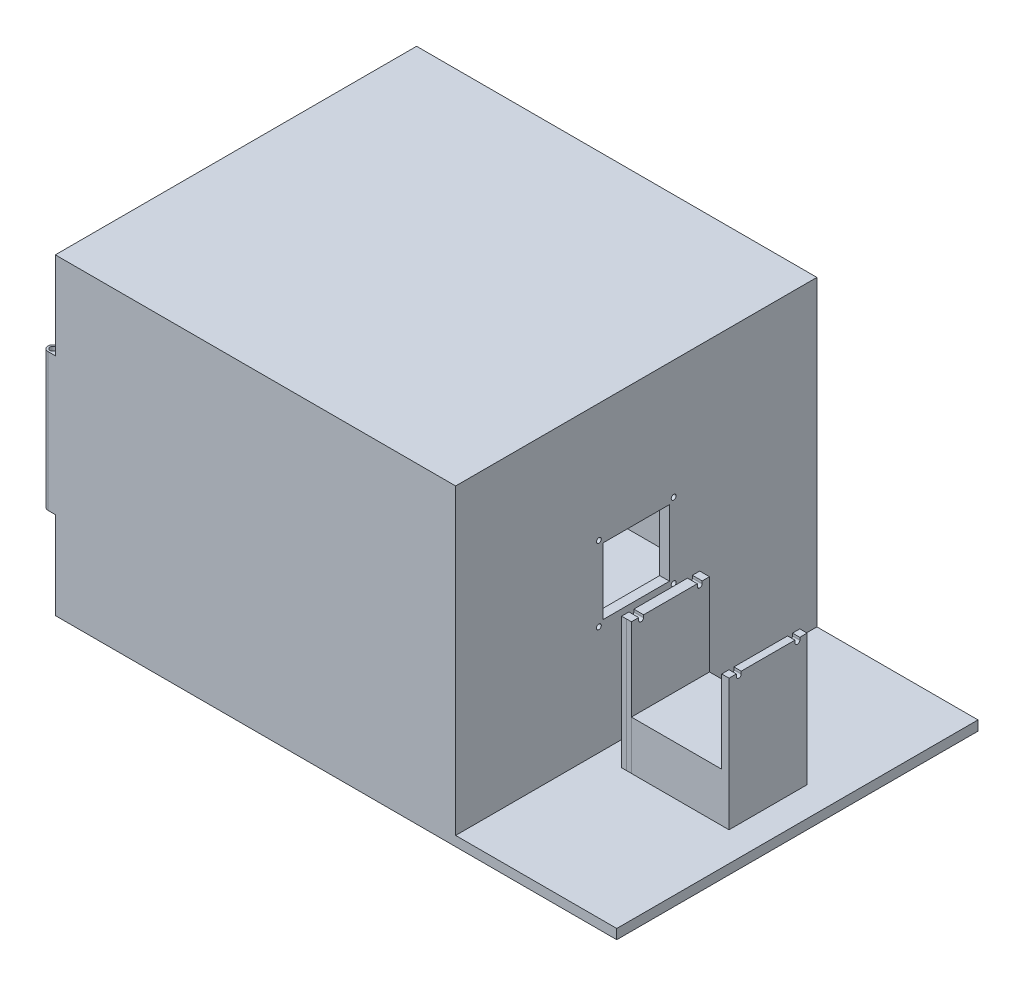
from build123d import *
from build123d.topology import SkipClean

# Parameters (mm, degrees)
SKETCH1_W           = 420
SKETCH1_H           = 370
SKETCH1_W_2         = 400
SKETCH1_H_2         = 350
BOSS_EXTRUDE1_DEPTH = 300
BOSS_EXTRUDE2_DEPTH = 10
SKETCH3_W           = 10
SKETCH3_H           = 310
CUT_EXTRUDE1_DEPTH  = 370
SKETCH6_R           = 2.5
SKETCH6_W           = 68
SKETCH6_H           = 68
CUT_EXTRUDE3_DEPTH  = 10
SKETCH7_W           = 5
SKETCH7_H           = 80
BOSS_EXTRUDE3_DEPTH = 134.5
CUT_EXTRUDE4_REACH  = 646.845
SKETCH9_W           = 5
SKETCH9_H           = 79.931817825
BOSS_EXTRUDE4_DEPTH = 134.5
CUT_EXTRUDE5_REACH  = 516.637
SKETCH10_W          = 6.47899954
SKETCH10_H          = 82.791783562
SKETCH11_W          = 5
SKETCH11_H          = 80
BOSS_EXTRUDE5_DEPTH = 134.5
SKETCH12_W          = 92.5
SKETCH12_H          = 80
BOSS_EXTRUDE6_DEPTH = 50
CUT_EXTRUDE6_START  = -7.5
CUT_EXTRUDE6_DEPTH  = 105
SKETCH15_W          = 410
SKETCH15_H          = 370
BOSS_EXTRUDE7_DEPTH = 10
SKETCH16_W          = 15
SKETCH16_H          = 140.878076228
BOSS_EXTRUDE8_DEPTH = 10
SKETCH17_R          = 3
CUT_EXTRUDE7_DEPTH  = 140.878076229


with BuildPart() as part:
    # Sketch1 → Boss-Extrude1 (new body)
    with BuildSketch(Plane(origin=(0, 0, 0), x_dir=(1, 0, 0), z_dir=(0, 1, 0))):
        Rectangle(SKETCH1_W, SKETCH1_H)
        Rectangle(SKETCH1_W_2, SKETCH1_H_2, mode=Mode.SUBTRACT)
    extrude(amount=BOSS_EXTRUDE1_DEPTH)

    # Sketch2 → Boss-Extrude2 (add)
    with BuildSketch(Plane.XZ):
        Polygon((-210, -185), (210, -185), (215.001407023, -185), (375.001407023, -185), (375.001407023, 185), (215.001407023, 185), (210, 185), (-210, 185), align=None)
    extrude(amount=BOSS_EXTRUDE2_DEPTH)

    # Sketch3 → Cut-Extrude1 (cut)
    with BuildSketch(Plane.XY.offset(185)):
        with Locations((-205, 145)):
            Rectangle(SKETCH3_W, SKETCH3_H)
    extrude(amount=-CUT_EXTRUDE1_DEPTH, mode=Mode.SUBTRACT)

    # Sketch6 → Cut-Extrude3 (cut)
    with BuildSketch(Plane(origin=(210, 0, 0), x_dir=(0, 0, -1), z_dir=(1, 0, 0))):
        with Locations((-38.303, 111.697)):
            Circle(SKETCH6_R)
        with Locations((38.303, 111.697)):
            Circle(SKETCH6_R)
        with Locations((38.303, 188.303)):
            Circle(SKETCH6_R)
        with Locations((-38.303, 188.303)):
            Circle(SKETCH6_R)
        with Locations((0, 150)):
            Rectangle(SKETCH6_W, SKETCH6_H)
    extrude(amount=-CUT_EXTRUDE3_DEPTH, mode=Mode.SUBTRACT)

    # Sketch7 → Boss-Extrude3 (add)
    with BuildSketch(Plane(origin=(0, 0, 0), x_dir=(1, 0, 0), z_dir=(0, 1, 0))):
        with Locations((237.5, 0)):
            Rectangle(SKETCH7_W, SKETCH7_H)
        with Locations((337.5, 0)):
            Rectangle(SKETCH7_W, SKETCH7_H)
    extrude(amount=BOSS_EXTRUDE3_DEPTH)

    # Cut-Extrude4: up to this face of the body (flat: up to its plane)
    cut_extrude4_end = Plane(part.part.faces().sort_by_distance((235, 67.25, 0))[0])
    # Sketch8 → Cut-Extrude4 (cut, up to the picked face)
    with BuildSketch(Plane(origin=(340, 0, 0), x_dir=(0, 0, -1), z_dir=(1, 0, 0)), mode=Mode.PRIVATE) as cut_extrude4_sk1:
        with BuildLine():
            Line((-32.5, 136.110518), (-32.220758703, 136.631471953))
            Line((-32.220758703, 136.631471953), (-27.5, 136.631471953))
            Line((-27.5, 136.631471953), (-27.5, 132))
            ThreePointArc((-27.5, 132), (-30, 129.5), (-32.5, 132))
            Line((-32.5, 132), (-32.5, 136.110518))
        make_face()
    cut_extrude4_tool1 = split(extrude(cut_extrude4_sk1.sketch, amount=-CUT_EXTRUDE4_REACH, mode=Mode.PRIVATE), bisect_by=cut_extrude4_end, keep=Keep.BOTH, mode=Mode.PRIVATE)
    # Sketch8 → Cut-Extrude4 (cut, up to the picked face)
    with BuildSketch(Plane(origin=(340, 0, 0), x_dir=(0, 0, -1), z_dir=(1, 0, 0)), mode=Mode.PRIVATE) as cut_extrude4_sk2:
        with BuildLine():
            Line((27.5, 132), (27.5, 136.631471953))
            Line((27.5, 136.631471953), (32.220758703, 136.631471953))
            Line((32.220758703, 136.631471953), (32.5, 136.110518))
            Line((32.5, 136.110518), (32.5, 132))
            ThreePointArc((32.5, 132), (30, 129.5), (27.5, 132))
        make_face()
    cut_extrude4_tool2 = split(extrude(cut_extrude4_sk2.sketch, amount=-CUT_EXTRUDE4_REACH, mode=Mode.PRIVATE), bisect_by=cut_extrude4_end, keep=Keep.BOTH, mode=Mode.PRIVATE)
    add(cut_extrude4_tool1.solids().sort_by(Axis((340, 133.303425, 29.994679), (-1, 0, 0)))[0], mode=Mode.SUBTRACT)
    add(cut_extrude4_tool2.solids().sort_by(Axis((340, 133.303425, -29.994679), (-1, 0, 0)))[0], mode=Mode.SUBTRACT)

    # Sketch9 → Boss-Extrude4 (add)
    with BuildSketch(Plane(origin=(0, 0, 0), x_dir=(1, 0, 0), z_dir=(0, 1, 0))):
        with Locations((242.5, 0.034091087)):
            Rectangle(SKETCH9_W, SKETCH9_H)
    extrude(amount=BOSS_EXTRUDE4_DEPTH)

    # Cut-Extrude5: up to this face of the body (flat: up to its plane)
    cut_extrude5_end = Plane(part.part.faces().sort_by_distance((337.5, 134.5, 0))[0])
    # Sketch10 → Cut-Extrude5 (cut, up to the picked face)
    with BuildSketch(Plane(origin=(0, 0, 0), x_dir=(1, 0, 0), z_dir=(0, 1, 0)), mode=Mode.PRIVATE) as cut_extrude5_sk1:
        with Locations((334.26050023, 1.395891781)):
            Rectangle(SKETCH10_W, SKETCH10_H)
    cut_extrude5_tool1 = split(extrude(cut_extrude5_sk1.sketch, amount=CUT_EXTRUDE5_REACH, mode=Mode.PRIVATE), bisect_by=cut_extrude5_end, keep=Keep.BOTH, mode=Mode.PRIVATE)
    add(cut_extrude5_tool1.solids().sort_by(Axis((334.2605, 0, -1.395892), (0, 1, 0)))[0], mode=Mode.SUBTRACT)

    # Sketch11 → Boss-Extrude5 (add)
    with BuildSketch(Plane(origin=(0, 0, 0), x_dir=(1, 0, 0), z_dir=(0, 1, 0))):
        with Locations((342.5, 0)):
            Rectangle(SKETCH11_W, SKETCH11_H)
    extrude(amount=BOSS_EXTRUDE5_DEPTH)

    # Sketch12 → Boss-Extrude6 (add)
    with BuildSketch(Plane(origin=(0, 0, 0), x_dir=(1, 0, 0), z_dir=(0, 1, 0))):
        with Locations((291.25, 0)):
            Rectangle(SKETCH12_W, SKETCH12_H)
    extrude(amount=BOSS_EXTRUDE6_DEPTH)

    # Sketch13 → Cut-Extrude6 (cut)
    with SkipClean():  # the faces are left unmerged after this step: merging them gives an invalid solid
        with BuildSketch(Plane.ZY.offset(-337.5).offset(CUT_EXTRUDE6_START)):
            with BuildLine():
                Line((-32.5, 132), (-32.5, 134.5))
                Line((-32.5, 134.5), (-27.5, 134.5))
                Line((-27.5, 134.5), (-27.5, 132))
                ThreePointArc((-27.5, 132), (-30, 129.5), (-32.5, 132))
            make_face()
            with BuildLine():
                Line((27.5, 132), (27.5, 134.5))
                Line((27.5, 134.5), (32.5, 134.5))
                Line((32.5, 134.5), (32.5, 132))
                ThreePointArc((32.5, 132), (30, 129.5), (27.5, 132))
            make_face()
        extrude(amount=CUT_EXTRUDE6_DEPTH, mode=Mode.SUBTRACT)
    add(part.part.scale(1), mode=Mode.REPLACE)  # the faces are merged on a copy

    # Sketch15 → Boss-Extrude7 (add)
    with BuildSketch(Plane(origin=(0, 300, 0), x_dir=(1, 0, 0), z_dir=(0, 1, 0))):
        with Locations((5, 0)):
            Rectangle(SKETCH15_W, SKETCH15_H)
    extrude(amount=BOSS_EXTRUDE7_DEPTH)

    # Sketch16 → Boss-Extrude8 (add)
    with BuildSketch(Plane.XY.offset(185)):
        with Locations((-207.5, 150)):
            Rectangle(SKETCH16_W, SKETCH16_H)
    extrude(amount=-BOSS_EXTRUDE8_DEPTH)

    # Sketch17 → Cut-Extrude7 (cut)
    with BuildSketch(Plane(origin=(0, 220.439038114, 0), x_dir=(1, 0, 0), z_dir=(0, 1, 0))):
        with Locations(Location((-207.5, -180, 0), (0, 0, 270))):
            Circle(SKETCH17_R)
        with BuildLine():
            Line((-207.5, -175), (-209.035864649, -172.521100774))
            Line((-209.035864649, -172.521100774), (-216.595230293, -172.09067426))
            Line((-216.595230293, -172.09067426), (-221.114708685, -175.883807911))
            Line((-221.114708685, -175.883807911), (-223.315292371, -184.798763984))
            Line((-223.315292371, -184.798763984), (-213.821165317, -189.967050938))
            Line((-213.821165317, -189.967050938), (-207.069572146, -188.808886591))
            Line((-207.069572146, -188.808886591), (-207.5, -185))
            ThreePointArc((-207.5, -185), (-212.5, -180), (-207.5, -175))
        make_face()
    extrude(amount=-CUT_EXTRUDE7_DEPTH, mode=Mode.SUBTRACT)


solid = part.part
